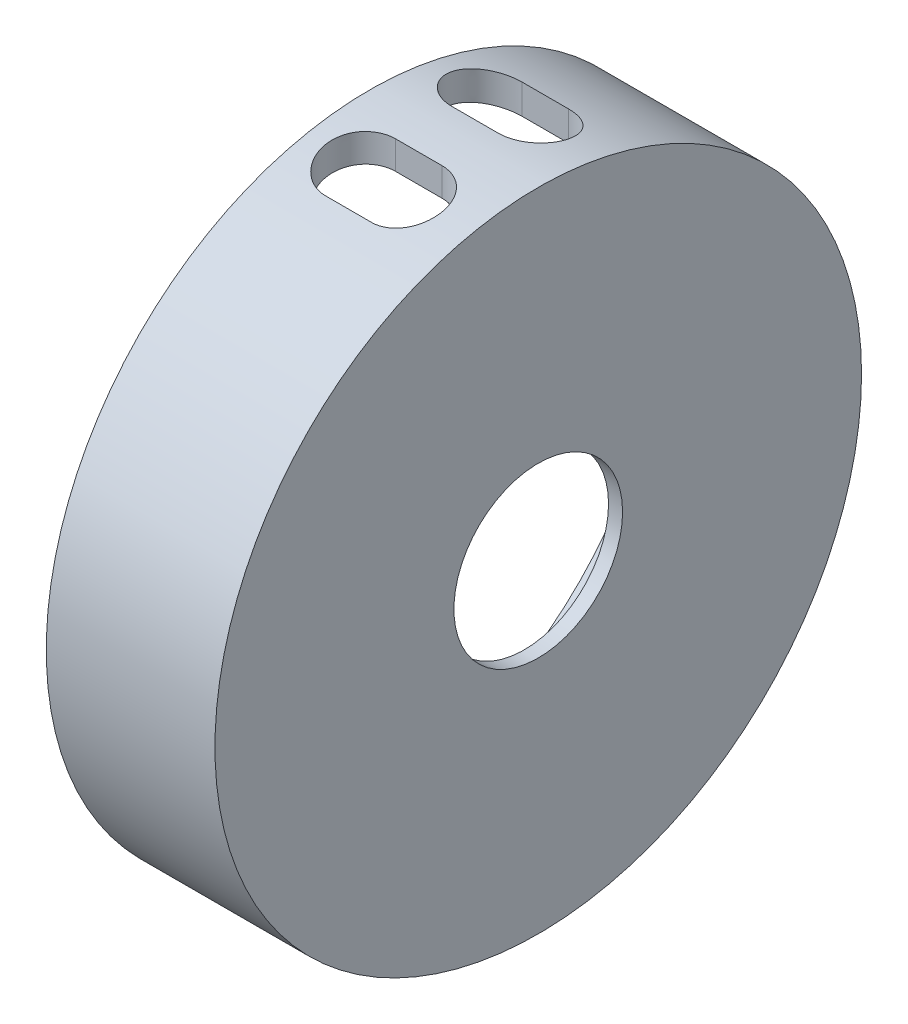
from build123d import *

# Parameters (mm, degrees)
SKETCH1_R           = 23
SKETCH1_R_2         = 21
BOSS_EXTRUDE1_DEPTH = 12
CUT_EXTRUDE1_START  = 19.798989767
CUT_EXTRUDE1_DEPTH  = 3.113888708
BOSS_EXTRUDE2_START = -1
SKETCH3_R           = 21
SKETCH3_R_2         = 6
BOSS_EXTRUDE2_DEPTH = 1


# Read off the part's stored shape, not the designer's step: Cut-Extrude1
with BuildPart() as part:
    # Sketch1 → Boss-Extrude1 (new body)
    with BuildSketch(Plane(origin=(0, 0, 0), x_dir=(0, 0, -1), z_dir=(1, 0, 0))):
        Circle(SKETCH1_R)
        Circle(SKETCH1_R_2, mode=Mode.SUBTRACT)
    extrude(amount=BOSS_EXTRUDE1_DEPTH)

    # Cut-Extrude1 outline → Cut-Extrude1 (cut)
    with BuildSketch(Plane(origin=(0, 0, 0), x_dir=(1, 0, 0), z_dir=(0, 1, 0)).offset(CUT_EXTRUDE1_START)):
        with BuildLine():
            Line((3.85, 2), (7.15, 2))
            add(Edge.make_bspline(
                [(7.15, 2), (7.817845854, 2), (8.470708827, 2.278069652), (9.392173726, 3.213958296), (9.654566139, 3.870579279), (9.645305955, 5.165184319), (9.383600306, 5.79959696), (8.460809694, 6.727038511), (7.818179406, 7), (7.15, 7)],
                knots=[0, 0, 0, 0, 0.25, 0.25, 0.5, 0.5, 0.75, 0.75, 1, 1, 1, 1], degree=3))
            Line((7.15, 7), (3.85, 7))
            add(Edge.make_bspline(
                [(3.85, 7), (3.181977083, 7), (2.533951966, 6.72160004), (1.622306662, 5.805707302), (1.355260445, 5.166655745), (1.344899993, 3.873398622), (1.601104231, 3.221423625), (2.533655688, 2.273000364), (3.182229779, 2), (3.85, 2)],
                knots=[0, 0, 0, 0, 0.25, 0.25, 0.5, 0.5, 0.75, 0.75, 1, 1, 1, 1], degree=3))
        make_face()
        with BuildLine():
            add(Edge.make_bspline(
                [(7.15, -2), (7.817845854, -2), (8.470708827, -2.278069652), (9.392173726, -3.213958296), (9.654566139, -3.870579279), (9.645305955, -5.165184319), (9.383600306, -5.79959696), (8.460809694, -6.727038511), (7.818179406, -7), (7.15, -7)],
                knots=[0, 0, 0, 0, 0.25, 0.25, 0.5, 0.5, 0.75, 0.75, 1, 1, 1, 1], degree=3))
            Line((7.15, -2), (3.85, -2))
            add(Edge.make_bspline(
                [(3.85, -7), (3.181977083, -7), (2.533951966, -6.72160004), (1.622306662, -5.805707302), (1.355260445, -5.166655745), (1.344899993, -3.873398622), (1.601104231, -3.221423625), (2.533655688, -2.273000364), (3.182229779, -2), (3.85, -2)],
                knots=[0, 0, 0, 0, 0.25, 0.25, 0.5, 0.5, 0.75, 0.75, 1, 1, 1, 1], degree=3))
            Line((3.85, -7), (7.15, -7))
        make_face()
    extrude(amount=CUT_EXTRUDE1_DEPTH, mode=Mode.SUBTRACT)

    # Sketch3 → Boss-Extrude2 (add)
    with BuildSketch(Plane(origin=(12, 0, 0), x_dir=(0, 0, -1), z_dir=(1, 0, 0)).offset(BOSS_EXTRUDE2_START)):
        Circle(SKETCH3_R)
        Circle(SKETCH3_R_2, mode=Mode.SUBTRACT)
    extrude(amount=BOSS_EXTRUDE2_DEPTH)


solid = part.part
